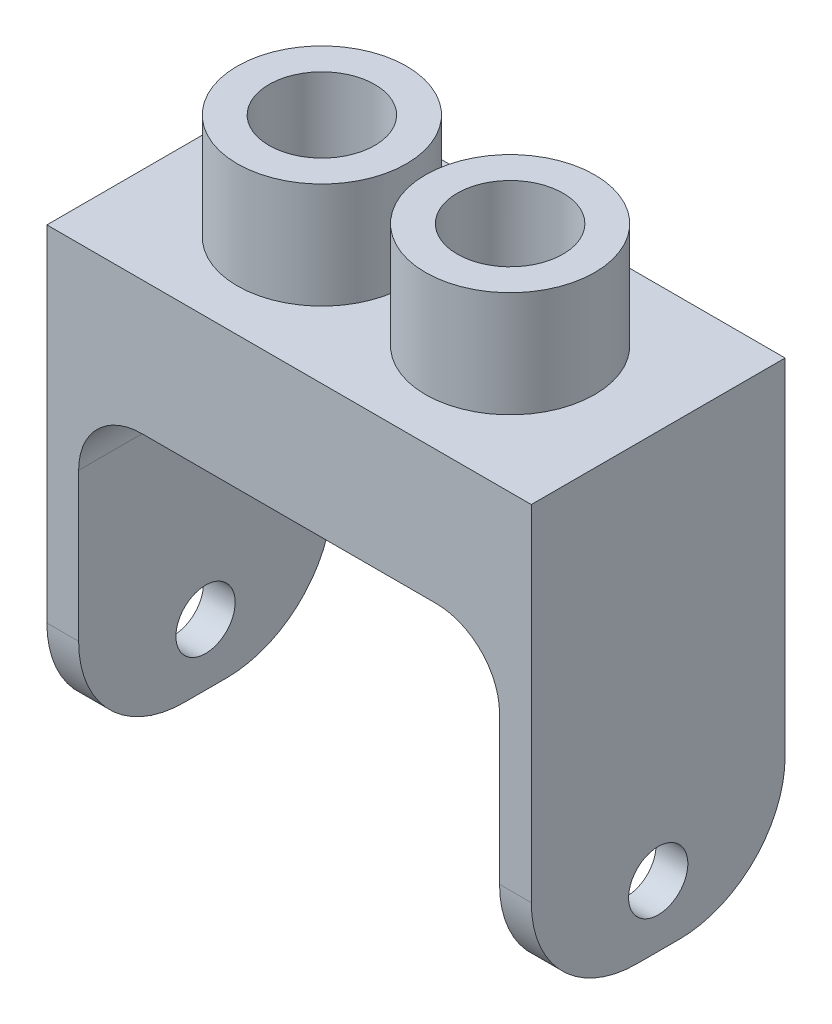
from build123d import *

# Parameters (mm, degrees)
BOSS_EXTRUDE1_OUTLINE_W = 22.9
BOSS_EXTRUDE1_OUTLINE_H = 12
BOSS_EXTRUDE1_DEPTH     = 6.3
SKETCH2_R               = 4
BOSS_EXTRUDE2_DEPTH     = 5
SKETCH3_R               = 2.5
CUT_EXTRUDE1_DEPTH      = 11.3
SKETCH4_W               = 1.5
SKETCH4_H               = 12
BOSS_EXTRUDE3_DEPTH     = 15
FILLET1_R               = 3
CUT_EXTRUDE2_REACH      = 30.025
SKETCH5_R               = 1.4
FILLET2_R               = 5


# Read off the part's stored shape, not the designer's step: Boss-Extrude1
with BuildPart() as part:
    # Boss-Extrude1 outline → Boss-Extrude1 (new body)
    with BuildSketch(Plane(origin=(0, 0, 0), x_dir=(1, 0, 0), z_dir=(0, 1, 0))):
        Rectangle(BOSS_EXTRUDE1_OUTLINE_W, BOSS_EXTRUDE1_OUTLINE_H)
    extrude(amount=BOSS_EXTRUDE1_DEPTH)

    # Sketch2 → Boss-Extrude2 (add)
    with BuildSketch(Plane(origin=(0, 6.3, 0), x_dir=(1, 0, 0), z_dir=(0, 1, 0))):
        with Locations(Location((-4.45, 0, 0), (0, 0, 90))):
            Circle(SKETCH2_R)
        with Locations(Location((4.45, 0, 0), (0, 0, 90))):
            Circle(SKETCH2_R)
    extrude(amount=BOSS_EXTRUDE2_DEPTH)

    # Sketch3 → Cut-Extrude1 (cut)
    with BuildSketch(Plane(origin=(0, 11.3, 0), x_dir=(1, 0, 0), z_dir=(0, 1, 0))):
        with Locations(Location((4.45, 0, 0), (0, 0, 270))):
            Circle(SKETCH3_R)
        with Locations(Location((-4.45, 0, 0), (0, 0, 270))):
            Circle(SKETCH3_R)
    extrude(amount=-CUT_EXTRUDE1_DEPTH, mode=Mode.SUBTRACT)

    # Sketch4 → Boss-Extrude3 (add)
    with BuildSketch(Plane.XZ):
        with Locations((-10.7, 0)):
            Rectangle(SKETCH4_W, SKETCH4_H)
        with Locations((10.7, 0)):
            Rectangle(SKETCH4_W, SKETCH4_H)
    extrude(amount=BOSS_EXTRUDE3_DEPTH)

    # Fillet1
    fillet1_edges = [part.edges().sort_by_distance(p)[0] for p in [
        (9.95, 0, 0),
        (-9.95, 0, 0),
    ]]
    fillet(fillet1_edges, radius=FILLET1_R - 0.0001)  # a hair under: the kernel refuses the full size

    # Cut-Extrude2: up to this face of the body (flat: up to its plane)
    cut_extrude2_end = Plane(part.part.faces().sort_by_distance((11.45, -4.35, 0))[0])
    # Sketch5 → Cut-Extrude2 (cut, up to the picked face)
    with BuildSketch(Plane.ZY.offset(11.45), mode=Mode.PRIVATE) as cut_extrude2_sk1:
        with Locations((0, -12.1)):
            Circle(SKETCH5_R)
    cut_extrude2_tool1 = split(extrude(cut_extrude2_sk1.sketch, amount=-CUT_EXTRUDE2_REACH, mode=Mode.PRIVATE), bisect_by=cut_extrude2_end, keep=Keep.BOTH, mode=Mode.PRIVATE)
    add(cut_extrude2_tool1.solids().sort_by(Axis((-11.45, -12.1, 0), (1, 0, 0)))[0], mode=Mode.SUBTRACT)

    # Fillet2
    fillet2_edges = [part.edges().sort_by_distance(p)[0] for p in [
        (-10.7, -15, -6),
        (-10.7, -15, 6),
        (10.7, -15, -6),
        (10.7, -15, 6),
    ]]
    fillet(fillet2_edges, radius=FILLET2_R)


solid = part.part
